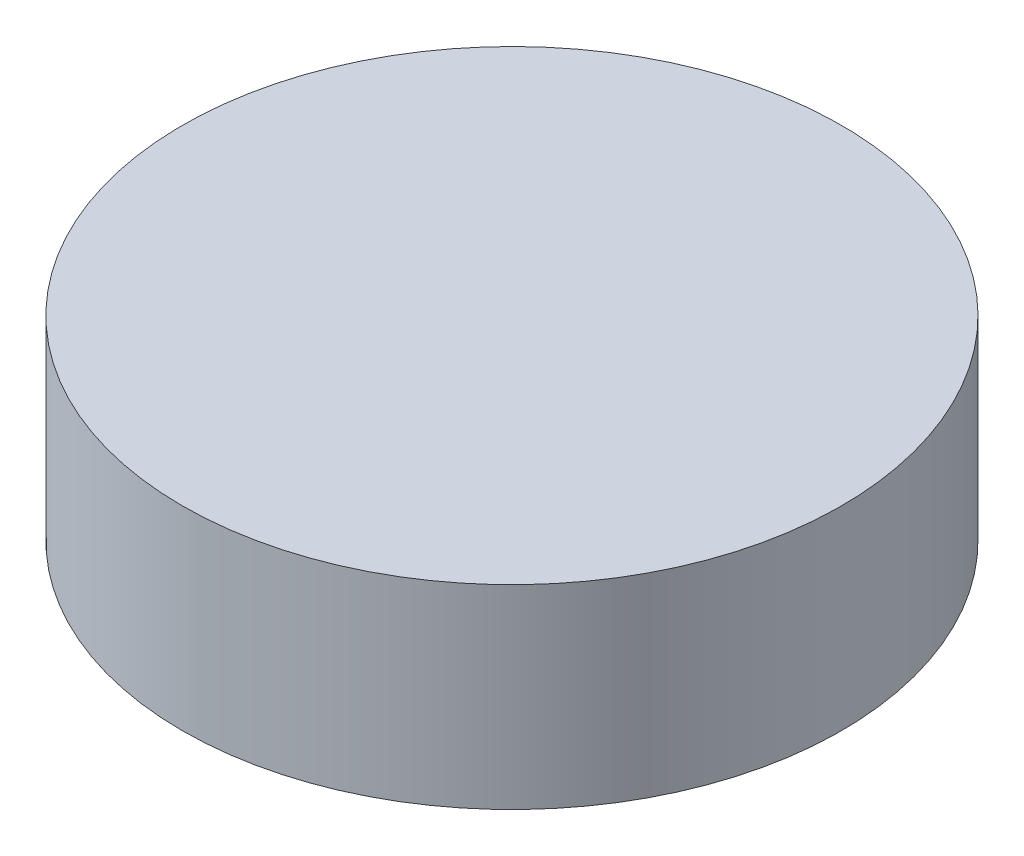
from build123d import *

# Parameters (mm, degrees)
SKETCH1_R           = 139.7
BOSS_EXTRUDE1_DEPTH = 82.55


with BuildPart() as part:
    # Sketch1 → Boss-Extrude1 (new body)
    with BuildSketch(Plane(origin=(0, 0, 0), x_dir=(1, 0, 0), z_dir=(0, 1, 0))):
        Circle(SKETCH1_R)
    extrude(amount=BOSS_EXTRUDE1_DEPTH)


solid = part.part
